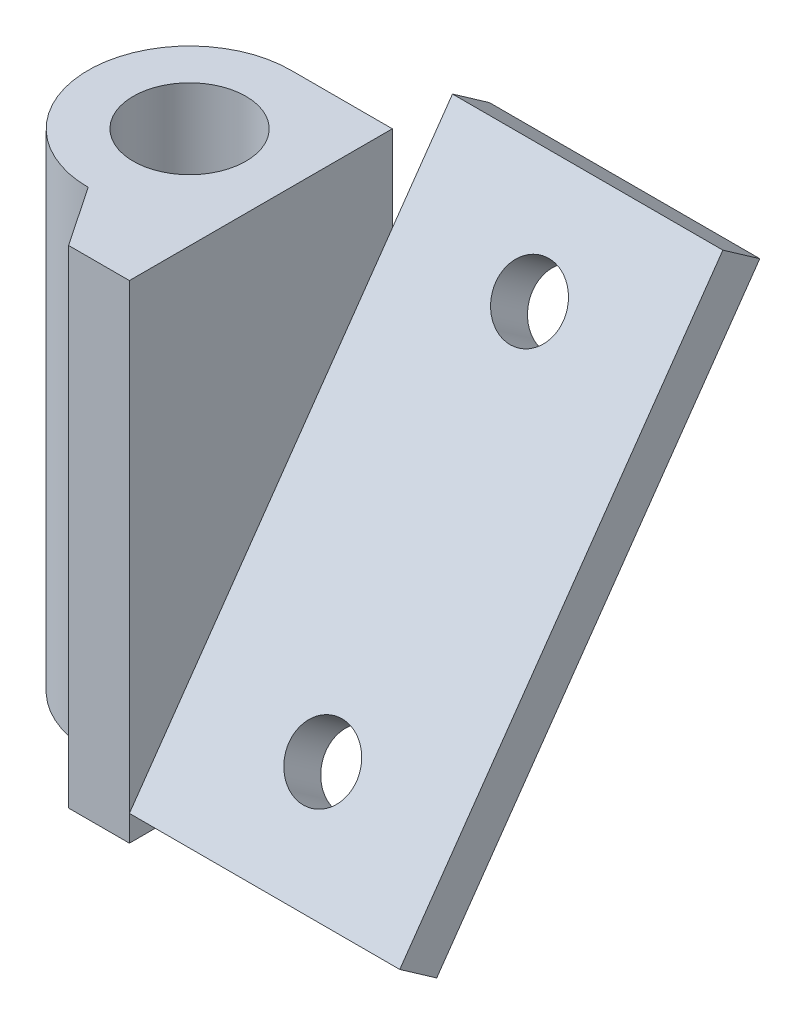
from build123d import *

# Parameters (mm, degrees)
CROQUIS1_R                   = 2.5000000000000004
SALIENTE_EXTRUIR1_DEPTH      = 10
SALIENTE_EXTRUIR2_DEPTH      = 12
CROQUIS3_R                   = 1.5000000000000024
SALIENTE_EXTRUIR3_DEPTH      = 2
REDONDEO1_R                  = 2
CROQUIS4_R                   = 1.5000000000000024
CORTAR_EXTRUIR1_DEPTH        = 6
SALIENTE_EXTRUIR4_DEPTH      = 3.21644
SALIENTE_EXTRUIR4_DEPTH_BACK = 18.409513
CROQUIS6_R                   = 2.5
SALIENTE_EXTRUIR5_START      = -21.625954
SALIENTE_EXTRUIR5_DEPTH      = 21.625954


with BuildPart() as part:
    # Croquis1 → Saliente-Extruir1 (new body)
    with BuildSketch(Plane(origin=(0, 0, 0), x_dir=(1, 0, 0), z_dir=(0, 1, 0))):
        with BuildLine():
            Line((0, -4.5), (4.5, -4.5))
            Line((4.5, -4.5), (4.5, 0))
            Line((4.5, 0), (4.5, 4.5))
            Line((4.5, 4.5), (0, 4.5))
            ThreePointArc((0, 4.5), (-4.5, 5.5e-16), (0, -4.5))
        make_face()
        with Locations(Location((0, 0, 0), (0, 0, 270))):
            Circle(CROQUIS1_R, mode=Mode.SUBTRACT)
    extrude(amount=SALIENTE_EXTRUIR1_DEPTH)

    # Croquis2 → Saliente-Extruir2 (add)
    with BuildSketch(Plane(origin=(4.5, 0, 0), x_dir=(0, 0, -1), z_dir=(1, 0, 0))):
        Polygon((-4.5, 0), (-4.5, 1.7434467956210846), (4.5, 14.596778856299984), (4.5, 11.10988526505781), (-3.2792254112385364, 0), align=None)
    extrude(amount=SALIENTE_EXTRUIR2_DEPTH)

    # Croquis3 → Saliente-Extruir3 (add)
    with BuildSketch(Plane(origin=(0, 2.68788483311935, 3.838697366771722), x_dir=(1, 0, 0), z_dir=(0, 0.57357643635105, 0.819152044288989))):
        Polygon((4.5, 19.19256462345726), (16.5, 19.19256462345726), (16.500000000000004, -5.807435376542737), (4.500000000000008, -5.807435376542739), align=None)
        with Locations(Location((10.5, 14.692564623457262, 0), (0, 0, 270))):
            Circle(CROQUIS3_R, mode=Mode.SUBTRACT)
        with Locations((10.500000000000002, -1.307435376542739)):
            Circle(CROQUIS3_R, mode=Mode.SUBTRACT)
    extrude(amount=-SALIENTE_EXTRUIR3_DEPTH)

    # Redondeo1
    # the kernel refuses this fillet: 2 mm, written as the material it adds along each edge
    with BuildSketch(Plane(origin=(4.5, 14.095760221444946, -6.590732152613882), x_dir=(0, -0.5735764363510499, -0.8191520442889891), z_dir=(0, -0.8191520442889891, 0.5735764363510499))) as redondeo1_piece_1_section:
        with BuildLine():
            CenterArc((REDONDEO1_R, REDONDEO1_R), REDONDEO1_R, 180, 90)
            Line((2.9e-16, REDONDEO1_R), (0, 0))
            Line((0, 0), (REDONDEO1_R, 0))
        make_face()
    redondeo1_piece_1 = extrude(amount=22.207745887614607, mode=Mode.PRIVATE)
    redondeo1_piece_1 = split(redondeo1_piece_1, bisect_by=Plane(origin=(4.952132948242019, 4.929093638164552, -4.5), z_dir=(0, 0, 1)), keep=Keep.TOP, mode=Mode.PRIVATE)
    redondeo1_piece_1 = split(redondeo1_piece_1, bisect_by=Plane(origin=(4.952132948242019, 10, -0.7036487498955591), z_dir=(0, -1, 0)), keep=Keep.TOP, mode=Mode.PRIVATE)
    redondeo1_piece_1 = split(redondeo1_piece_1, bisect_by=Plane(origin=(4.952132948242019, 0, -0.7036487498955591), z_dir=(0, 1, 0)), keep=Keep.TOP, mode=Mode.PRIVATE)
    add(redondeo1_piece_1)

    # Croquis4 → Cortar-Extruir1 (cut)
    with BuildSketch(Plane(origin=(0, 2.68788483311935, 3.838697366771722), x_dir=(1, 0, 0), z_dir=(0, 0.57357643635105, 0.819152044288989))):
        with Locations(Location((10.5, 14.69256462345726, 0), (0, 0, 270))):
            Circle(CROQUIS4_R)
        with Locations(Location((10.500000000000002, -1.3074353765427391, 0), (0, 0, 270))):
            Circle(CROQUIS4_R)
    extrude(amount=-CORTAR_EXTRUIR1_DEPTH, mode=Mode.SUBTRACT)

    # Croquis6 → Saliente-Extruir4 (add, two sides: drawn at the far end of the back side and taken through both)
    with BuildSketch(Plane.XZ.offset(-SALIENTE_EXTRUIR4_DEPTH_BACK)):
        with BuildLine():
            Line((4.5, -4.5), (0, -4.5))
            ThreePointArc((0, -4.5), (-4.5, 5.5e-16), (0, 4.5))
            Line((0, 4.5), (4.500000000000005, 4.5))
            Line((4.500000000000005, 4.5), (4.5, -4.5))
        make_face()
        with Locations(Location((0, 0, 0), (0, 0, 270))):
            Circle(CROQUIS6_R, mode=Mode.SUBTRACT)
    extrude(amount=SALIENTE_EXTRUIR4_DEPTH + SALIENTE_EXTRUIR4_DEPTH_BACK)

    # Croquis7 → Saliente-Extruir5 (add)
    with BuildSketch(Plane(origin=(0, 18.409513379572896, 0), x_dir=(1, 0, 0), z_dir=(0, 1, 0)).offset(SALIENTE_EXTRUIR5_START)):
        Polygon((5.5e-16, -4.5), (1.8007390664454916, -7.169705454388125), (4.500000000000005, -7.169705454388125), (4.500000000000005, -4.5), align=None)
    extrude(amount=SALIENTE_EXTRUIR5_DEPTH)


solid = part.part
